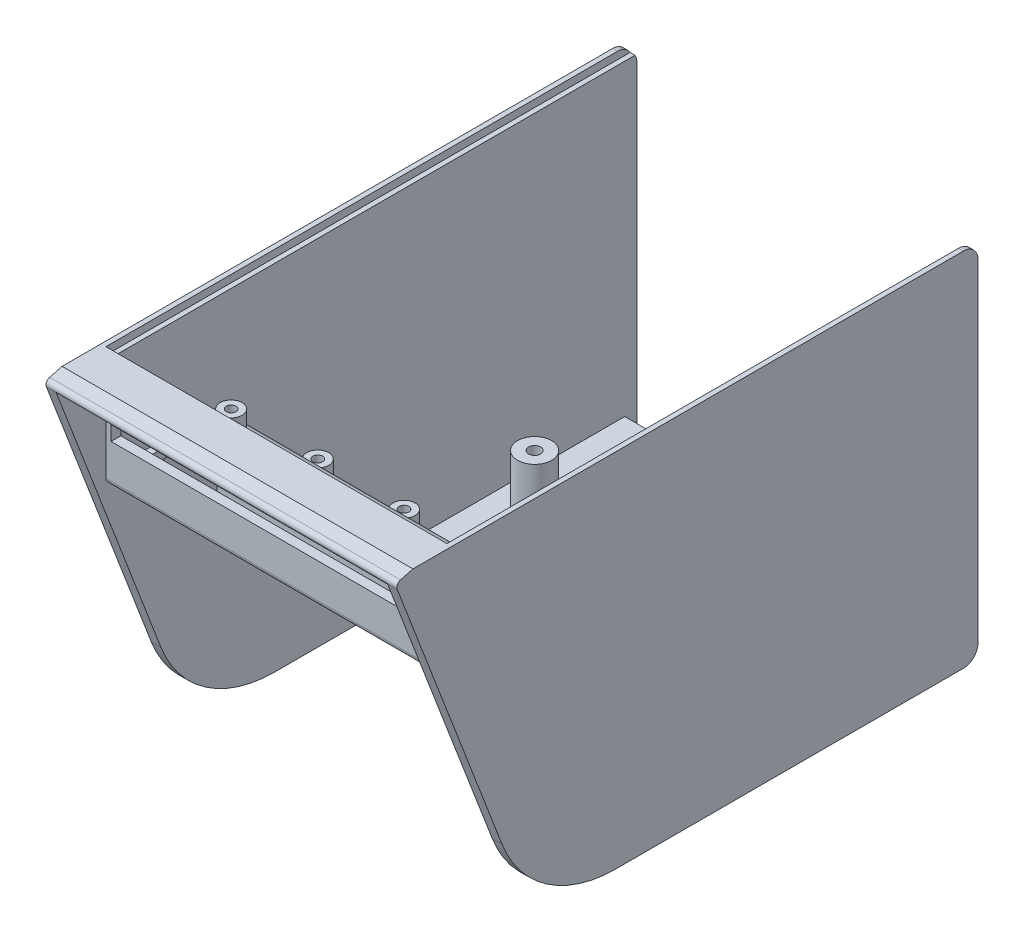
from build123d import *

# Parameters (mm, degrees)
SKETCH1_W                       = 72
SKETCH1_H                       = 108.98
BOSS_EXTRUDE1_DEPTH             = 66.66
CUT_EXTRUDE1_DEPTH              = 113.2350912148246
CUT_EXTRUDE1_DEPTH_BACK         = 113.2350912148246
FILLET1_R                       = 1
SHELL1_T                        = -2
CUT_EXTRUDE2_REACH              = 80.325
CUT_EXTRUDE3_REACH              = 79.218
CUT_EXTRUDE4_REACH              = 89.999
BOSS_EXTRUDE2_DEPTH             = 4.5
BOSS_EXTRUDE2_DEPTH_BACK        = 2
SKETCH7_R                       = 2.2499999999999996
SKETCH8_R                       = 2.2499999999999987
BOSS_EXTRUDE3_DEPTH             = 4.5
BOSS_EXTRUDE3_DIRECTION_2_REACH = 78.17
BOSS_EXTRUDE4_DEPTH             = 4.5
BOSS_EXTRUDE4_DEPTH_BACK        = 2
SKETCH9_R                       = 2.249999999999999
CUT_EXTRUDE5_REACH              = 134.726
SKETCH10_W                      = 66.01632466053066
SKETCH10_H                      = 3.0183213173790264
SKETCH11_R                      = 3.4999999999999996
BOSS_EXTRUDE5_DEPTH             = 12.22
BOSS_EXTRUDE6_DEPTH             = 2
SKETCH20_W                      = 67.99999999999999
SKETCH20_H                      = 10.999999999999993
BOSS_EXTRUDE7_DEPTH             = 2
CUT_EXTRUDE12_DEPTH             = 118.96819783314486
CHAMFER1_SIZE                   = 4
CHAMFER1_SIZE2                  = 1.040978771037234
FILLET3_R                       = 1
CUT_EXTRUDE6_REACH              = 101.683
SKETCH13_W                      = 68.195
SKETCH13_H                      = 2.5
FILLET4_R                       = 3
FILLET5_R                       = 3
CUT_EXTRUDE7_DEPTH              = 1.5
CUT_EXTRUDE8_REACH              = 101.683
SKETCH16_R                      = 1.2500000000000013
SKETCH17_R                      = 1.0000000000000016
CUT_EXTRUDE9_DEPTH              = 4
SKETCH18_R                      = 1.0000000000000018
CUT_EXTRUDE10_DEPTH             = 4
SKETCH19_R                      = 1.0000000000000018
CUT_EXTRUDE11_DEPTH             = 4


with BuildPart() as part:
    # Sketch1 → Boss-Extrude1 (new body)
    with BuildSketch(Plane(origin=(0, 0, 0), x_dir=(1, 0, 0), z_dir=(0, 1, 0))):
        Rectangle(SKETCH1_W, SKETCH1_H)
    extrude(amount=BOSS_EXTRUDE1_DEPTH)

    # Sketch2 → Cut-Extrude1 (cut, two sides: drawn at the far end of the back side and taken through both)
    with BuildSketch(Plane(origin=(36, 0, 0), x_dir=(0, 0, -1), z_dir=(1, 0, 0)).offset(-CUT_EXTRUDE1_DEPTH_BACK)):
        Polygon((-54.49000000000001, 332.16104500764766), (-54.49000000000001, 66.66), (-54.49000000000001, 43.239999999999995), (-31.71, 43.239999999999995), (-31.71, 25.459999999999997), (-14.010000000000009, 25.459999999999997), (-14.010000000000009, 7.68), (3.849999999999999, 7.68), (3.849999999999999, 0), (3.849999999999999, -265.5010450076477), (-524.6402178733546, -317.0889235527675), (-582.9802178733546, 280.57316646252787), align=None)
    extrude(amount=CUT_EXTRUDE1_DEPTH + CUT_EXTRUDE1_DEPTH_BACK, mode=Mode.SUBTRACT)

    # Fillet1
    fillet1_edges = [part.edges().sort_by_distance(p)[0] for p in [
        (0, 0, -3.849999999999999),
        (0, 43.239999999999995, 31.71),
        (0, 25.459999999999997, 31.71),
        (0, 25.459999999999997, 14.010000000000009),
        (0, 7.68, 14.010000000000009),
        (0, 43.239999999999995, 54.49000000000001),
        (0, 7.68, -3.849999999999999),
    ]]
    fillet(fillet1_edges, radius=FILLET1_R)

    # Shell1
    shell1_openings = [part.faces().sort_by_distance(p)[0] for p in [
        (0, 66.66, 0),
        (0, 33.33, -54.49),
    ]]
    offset(amount=SHELL1_T, openings=shell1_openings, kind=Kind.INTERSECTION)

    # Sketch3 → Cut-Extrude2 (cut, up to next)
    with BuildSketch(Plane.XZ.offset(-43.239999999999995), mode=Mode.PRIVATE) as cut_extrude2_sk1:
        Polygon((-32.49999999999997, 47.39000000000001), (32.5, 47.39000000000002), (32.5, 37.39000000000002), (-32.5, 37.39000000000011), align=None)
    cut_extrude2_tool1 = extrude(cut_extrude2_sk1.sketch, amount=-CUT_EXTRUDE2_REACH, mode=Mode.PRIVATE) & part.part
    add(cut_extrude2_tool1.solids().sort_by_distance((0, 43.24, 42.39))[0], mode=Mode.SUBTRACT)

    # Sketch4 → Cut-Extrude3 (cut, up to next)
    with BuildSketch(Plane.XZ.offset(-25.459999999999997), mode=Mode.PRIVATE) as cut_extrude3_sk1:
        Polygon((-32.49999999999997, 29.61), (32.5, 29.61), (32.50000000000001, 19.610000000000003), (-32.49999999999997, 19.610000000000003), align=None)
    cut_extrude3_tool1 = extrude(cut_extrude3_sk1.sketch, amount=-CUT_EXTRUDE3_REACH, mode=Mode.PRIVATE) & part.part
    add(cut_extrude3_tool1.solids().sort_by_distance((0, 25.46, 24.61))[0], mode=Mode.SUBTRACT)

    # Sketch5 → Cut-Extrude4 (cut, up to next)
    with BuildSketch(Plane.XZ.offset(-7.68), mode=Mode.PRIVATE) as cut_extrude4_sk1:
        Polygon((-32.49999999999997, 11.910000000000007), (32.50000000000001, 11.910000000000007), (32.5, 1.9100000000000072), (-32.49999999999997, 1.9100000000000068), align=None)
    cut_extrude4_tool1 = extrude(cut_extrude4_sk1.sketch, amount=-CUT_EXTRUDE4_REACH, mode=Mode.PRIVATE) & part.part
    add(cut_extrude4_tool1.solids().sort_by_distance((0, 7.68, 6.91))[0], mode=Mode.SUBTRACT)

    # Sketch7 → Boss-Extrude2 (add, two sides: drawn at the far end of the back side and taken through both)
    with BuildSketch(Plane(origin=(0, 45.239999999999995, 0), x_dir=(1, 0, 0), z_dir=(0, 1, 0)).offset(-BOSS_EXTRUDE2_DEPTH_BACK)):
        with Locations(Location((-27.999999999999996, -34.790000000000106, 0), (0, 0, 112.415269488))):
            Circle(SKETCH7_R)
        with Locations(Location((28.000000000000004, -34.790000000000106, 0), (0, 0, 112.415269488))):
            Circle(SKETCH7_R)
    extrude(amount=BOSS_EXTRUDE2_DEPTH + BOSS_EXTRUDE2_DEPTH_BACK)

    # Sketch8 → Boss-Extrude3 (add)
    with BuildSketch(Plane(origin=(0, 27.459999999999997, 0), x_dir=(1, 0, 0), z_dir=(0, 1, 0))):
        with Locations(Location((-27.999999999999996, -17.010000000000005, 0), (0, 0, 270))):
            Circle(SKETCH8_R)
        with Locations(Location((28.000000000000004, -17.010000000000005, 0), (0, 0, 270))):
            Circle(SKETCH8_R)
    extrude(amount=BOSS_EXTRUDE3_DEPTH)

    # Sketch8 → Boss-Extrude3 direction 2 (add, up to next)
    with BuildSketch(Plane(origin=(0, 27.459999999999997, 0), x_dir=(1, 0, 0), z_dir=(0, 1, 0)), mode=Mode.PRIVATE) as boss_extrude3_direction_2_sk1:
        with Locations(Location((-27.999999999999996, -17.010000000000005, 0), (0, 0, 270))):
            Circle(SKETCH8_R)
    boss_extrude3_direction_2_tool1 = extrude(boss_extrude3_direction_2_sk1.sketch, amount=-BOSS_EXTRUDE3_DIRECTION_2_REACH, mode=Mode.PRIVATE) - part.part
    # Sketch8 → Boss-Extrude3 direction 2 (add, up to next)
    with BuildSketch(Plane(origin=(0, 27.459999999999997, 0), x_dir=(1, 0, 0), z_dir=(0, 1, 0)), mode=Mode.PRIVATE) as boss_extrude3_direction_2_sk2:
        with Locations(Location((28.000000000000004, -17.010000000000005, 0), (0, 0, 270))):
            Circle(SKETCH8_R)
    boss_extrude3_direction_2_tool2 = extrude(boss_extrude3_direction_2_sk2.sketch, amount=-BOSS_EXTRUDE3_DIRECTION_2_REACH, mode=Mode.PRIVATE) - part.part
    add(boss_extrude3_direction_2_tool1.solids().sort_by_distance((-28, 27.46, 17.01))[0])
    add(boss_extrude3_direction_2_tool2.solids().sort_by_distance((28, 27.46, 17.01))[0])

    # Sketch9 → Boss-Extrude4 (add, two sides: drawn at the far end of the back side and taken through both)
    with BuildSketch(Plane(origin=(0, 9.68, 0), x_dir=(1, 0, 0), z_dir=(0, 1, 0)).offset(-BOSS_EXTRUDE4_DEPTH_BACK)):
        with Locations(Location((-28, 0.6899999999999932, 0), (0, 0, 106.260204708))):
            Circle(SKETCH9_R)
        with Locations(Location((28, 0.6899999999999932, 0), (0, 0, 73.739795292))):
            Circle(SKETCH9_R)
    extrude(amount=BOSS_EXTRUDE4_DEPTH + BOSS_EXTRUDE4_DEPTH_BACK)

    # Sketch10 → Cut-Extrude5 (cut, up to next)
    with BuildSketch(Plane.XY.offset(54.49), mode=Mode.PRIVATE) as cut_extrude5_sk1:
        with Locations((0.07217277726232396, 52.84916065868947)):
            Rectangle(SKETCH10_W, SKETCH10_H)
    cut_extrude5_tool1 = extrude(cut_extrude5_sk1.sketch, amount=-CUT_EXTRUDE5_REACH, mode=Mode.PRIVATE) & part.part
    add(cut_extrude5_tool1.solids().sort_by_distance((0.072173, 52.849161, 54.49))[0], mode=Mode.SUBTRACT)

    # Sketch11 → Boss-Extrude5 (add)
    with BuildSketch(Plane(origin=(0, 2, 0), x_dir=(1, 0, 0), z_dir=(0, 1, 0))):
        with Locations(Location((-25, 24.490000000000006, 0), (0, 0, 90))):
            Circle(SKETCH11_R)
        with Locations(Location((24.999999999999996, 24.490000000000006, 0), (0, 0, 90))):
            Circle(SKETCH11_R)
    extrude(amount=BOSS_EXTRUDE5_DEPTH)

    # Sketch12 → Boss-Extrude6 (add)
    with BuildSketch(Plane.ZY.offset(36)):
        with BuildLine():
            Line((54.49000000000001, 66.66), (65.49000000000001, 66.66))
            Line((65.49000000000001, 66.66), (43.18012985916296, 8.540801261367385))
            ThreePointArc((43.18012985916296, 8.540801261367385), (34.00077511985373, -3.103154715550435), (19.840619196732938, -7.5))
            Line((19.840619196732938, -7.5), (-54.489999999999995, -7.5))
            Line((-54.489999999999995, -7.5), (-54.489999999999995, 0))
            Line((-54.489999999999995, 0), (54.49000000000001, 66.66))
        make_face()
    boss_extrude6 = extrude(amount=-BOSS_EXTRUDE6_DEPTH)

    # Mirror1: Boss-Extrude6 across plane
    add(boss_extrude6.mirror(Plane(origin=(0, 0, 0), x_dir=(0, 0, 1), z_dir=(1, 0, 0))))

    # Sketch20 → Boss-Extrude7 (add)
    with BuildSketch(Plane(origin=(0, 66.66, 0), x_dir=(1, 0, 0), z_dir=(0, 1, 0))):
        with Locations((0, -59.99000000000001)):
            Rectangle(SKETCH20_W, SKETCH20_H)
    extrude(amount=-BOSS_EXTRUDE7_DEPTH)

    # Sketch21 → Cut-Extrude12 (cut, through all)
    with BuildSketch(Plane(origin=(36, 0, 0), x_dir=(0, 0, -1), z_dir=(1, 0, 0))):
        Polygon((-65.49000000000001, 66.66), (-64.37613505079734, 63.75828260128645), (-66.43718019629259, 63.75828260128645), align=None)
    extrude(amount=-CUT_EXTRUDE12_DEPTH, mode=Mode.SUBTRACT)

    # Chamfer1
    chamfer1_edges = [part.edges().sort_by_distance(p)[0] for p in [
        (0, 66.66, 65.49000000000001),
    ]]
    chamfer1_side = [part.faces().sort_by_distance(p)[0] for p in [
        (0, 66.66, 64.09074304003876),
    ]]
    chamfer(chamfer1_edges, length=CHAMFER1_SIZE, length2=CHAMFER1_SIZE2, reference=chamfer1_side[0])

    # Fillet3
    # the kernel refuses this fillet: 1 mm, written as the material it takes off along each edge
    with BuildSketch(Plane(origin=(38.776531287073006, 65.68816259496053, 65.1169465723032), x_dir=(0, -0.9335804264971989, -0.3583679495453075), z_dir=(-1, 0, 0))) as fillet3_piece_1:
        with BuildLine():
            CenterArc((FILLET3_R * 1.11061251483, -FILLET3_R), FILLET3_R, 89.99999999999986, 96.00000000000023)
            Line((FILLET3_R * 0.116090619461, -FILLET3_R * 1.10452846327), (0, 0))
            Line((0, 0), (FILLET3_R * 1.11061251483, -1e-17))
        make_face()
    extrude(amount=77.553062574146, mode=Mode.SUBTRACT)

    # Sketch13 → Cut-Extrude6 (cut, up to next)
    with BuildSketch(Plane.XZ, mode=Mode.PRIVATE) as cut_extrude6_sk1:
        with Locations((0.09750000000000014, -53.239999999999995)):
            Rectangle(SKETCH13_W, SKETCH13_H)
    cut_extrude6_tool1 = extrude(cut_extrude6_sk1.sketch, amount=-CUT_EXTRUDE6_REACH, mode=Mode.PRIVATE) & part.part
    add(cut_extrude6_tool1.solids().sort_by_distance((0.0975, 0, -53.24))[0], mode=Mode.SUBTRACT)

    # Fillet4
    fillet4_edges = [part.edges().sort_by_distance(p)[0] for p in [
        (-35, 66.66, -54.49),
        (35.0975, 66.66, -54.49),
    ]]
    fillet(fillet4_edges, radius=FILLET4_R)

    # Fillet5
    fillet5_edges = [part.edges().sort_by_distance(p)[0] for p in [
        (-35, -7.5, -54.489999999999995),
        (35, -7.5, -54.489999999999995),
    ]]
    fillet(fillet5_edges, radius=FILLET5_R)

    # Sketch14 → Cut-Extrude7 (cut)
    with BuildSketch(Plane(origin=(0, 66.66, 0), x_dir=(1, 0, 0), z_dir=(0, 1, 0))):
        Polygon((-35.00000000000001, 60.23028837934256), (34.99999999999999, 60.23028837934257), (34.99999999999999, -53.49), (-34.99999999999999, -53.49), align=None)
    extrude(amount=-CUT_EXTRUDE7_DEPTH, mode=Mode.SUBTRACT)

    # Sketch16 → Cut-Extrude8 (cut, up to next)
    with BuildSketch(Plane.XZ, mode=Mode.PRIVATE) as cut_extrude8_sk1:
        with Locations(Location((-24.999999999999993, -24.489999999999995, 0), (0, 0, 270))):
            Circle(SKETCH16_R)
    cut_extrude8_tool1 = extrude(cut_extrude8_sk1.sketch, amount=-CUT_EXTRUDE8_REACH, mode=Mode.PRIVATE) & part.part
    # Sketch16 → Cut-Extrude8 (cut, up to next)
    with BuildSketch(Plane.XZ, mode=Mode.PRIVATE) as cut_extrude8_sk2:
        with Locations(Location((24.999999999999993, -24.489999999999995, 0), (0, 0, 270))):
            Circle(SKETCH16_R)
    cut_extrude8_tool2 = extrude(cut_extrude8_sk2.sketch, amount=-CUT_EXTRUDE8_REACH, mode=Mode.PRIVATE) & part.part
    add(cut_extrude8_tool1.solids().sort_by_distance((-25, 0, -24.49))[0], mode=Mode.SUBTRACT)
    add(cut_extrude8_tool2.solids().sort_by_distance((25, 0, -24.49))[0], mode=Mode.SUBTRACT)

    # Sketch17 → Cut-Extrude9 (cut)
    with BuildSketch(Plane(origin=(0, 14.179999999999998, 0), x_dir=(1, 0, 0), z_dir=(0, 1, 0))):
        with Locations(Location((-28, 0.6899999999999932, 0), (0, 0, 270))):
            Circle(SKETCH17_R)
        with Locations(Location((28, 0.6899999999999932, 0), (0, 0, 270))):
            Circle(SKETCH17_R)
    extrude(amount=-CUT_EXTRUDE9_DEPTH, mode=Mode.SUBTRACT)

    # Sketch18 → Cut-Extrude10 (cut)
    with BuildSketch(Plane(origin=(0, 31.959999999999994, 0), x_dir=(1, 0, 0), z_dir=(0, 1, 0))):
        with Locations(Location((-27.999999999999996, -17.010000000000005, 0), (0, 0, 270))):
            Circle(SKETCH18_R)
        with Locations(Location((28.000000000000004, -17.010000000000005, 0), (0, 0, 270))):
            Circle(SKETCH18_R)
    extrude(amount=-CUT_EXTRUDE10_DEPTH, mode=Mode.SUBTRACT)

    # Sketch19 → Cut-Extrude11 (cut)
    with BuildSketch(Plane(origin=(0, 49.739999999999995, 0), x_dir=(1, 0, 0), z_dir=(0, 1, 0))):
        with Locations(Location((-27.999999999999996, -34.790000000000106, 0), (0, 0, 270))):
            Circle(SKETCH19_R)
        with Locations(Location((28.000000000000004, -34.790000000000106, 0), (0, 0, 270))):
            Circle(SKETCH19_R)
    extrude(amount=-CUT_EXTRUDE11_DEPTH, mode=Mode.SUBTRACT)


solid = part.part
